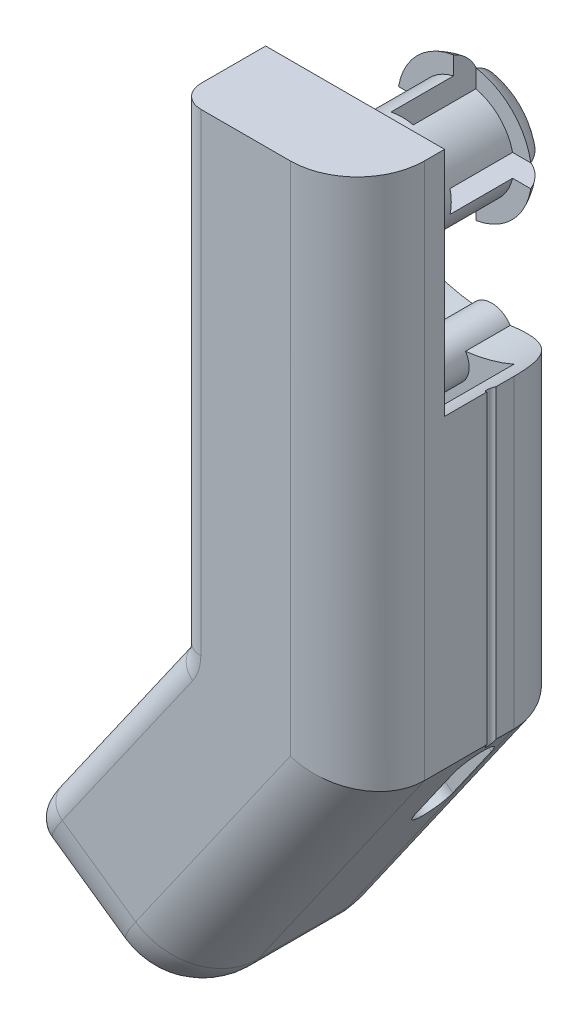
from build123d import *

# Parameters (mm, degrees)
BOSS_EXTRUDE1_DEPTH      = 5.715
BOSS_EXTRUDE1_DEPTH_BACK = 4.445
SKETCH2_R                = 2.7940000000000054
SKETCH3_W                = 1.269999999999993
SKETCH3_H                = 1.2700000000000102
CUT_EXTRUDE1_DEPTH       = 5.08
BOSS_EXTRUDE2_DEPTH      = 1.524
FILLET1_R                = 2.54
BOSS_EXTRUDE3_DEPTH      = 2.54
BOSS_EXTRUDE3_DEPTH_BACK = 2.413
SKETCH5_R                = 2.7940000000000054
BOSS_EXTRUDE4_DEPTH      = 7.747
CUT_EXTRUDE2_START       = -1.397
CUT_EXTRUDE2_DEPTH       = 5.207
CUT_EXTRUDE5_DEPTH       = 1.27
BOSS_EXTRUDE5_REACH      = 139.144
SKETCH11_R               = 1.2700000000000067
CUT_EXTRUDE6_DEPTH       = 37.8413328747807
CUT_EXTRUDE6_DEPTH_BACK  = 37.8413328747807
SKETCH12_R               = 0.25399999999999967
FILLET2_R                = 3.8099999999999996
FILLET3_R                = 3.8099999999999996
FILLET4_R                = 1.27


with BuildPart() as part:
    # Sketch2 → Boss-Extrude1 (new, two sides: drawn at the far end of the back side and taken through both)
    with BuildSketch(Plane.XY.offset(-BOSS_EXTRUDE1_DEPTH_BACK)):
        with Locations((-4.07886393202022, -93.55895801032833)):
            Circle(SKETCH2_R)
    extrude(amount=BOSS_EXTRUDE1_DEPTH + BOSS_EXTRUDE1_DEPTH_BACK)

    # Sketch3 → Cut-Extrude1 (cut)
    with BuildSketch(Plane(origin=(0, 0, -4.445), x_dir=(-1, 0, 0), z_dir=(0, 0, -1))):
        with BuildLine():
            Line((3.443863932020214, -94.1939580103283), (3.443863932020214, -92.9239580103283))
            Line((3.4438639320202142, -92.9239580103283), (1.357979700745413, -92.9239580103283))
            ThreePointArc((1.3579797007454042, -92.92395801032826), (1.3032030609678973, -93.23936024921431), (1.2848639320202149, -93.55895801032833))
            ThreePointArc((1.2848639320202149, -93.55895801032833), (1.3032030609678946, -93.87855577144232), (1.3579797007453935, -94.19395801032834))
            Line((1.357979700745402, -94.1939580103283), (3.4438639320202142, -94.1939580103283))
        make_face()
        with Locations((4.0788639320202105, -93.5589580103283)):
            Rectangle(SKETCH3_W, SKETCH3_H)
        with BuildLine():
            ThreePointArc((4.713863932020238, -90.8380737790535), (4.398461693134176, -90.783297139276), (4.078863932020155, -90.76495801032831))
            ThreePointArc((4.078863932020155, -90.76495801032831), (3.7592661709062294, -90.783297139276), (3.4438639320202613, -90.83807377905349))
            Line((3.4438639320202147, -90.83807377905347), (3.443863932020214, -92.9239580103283))
            Line((3.4438639320202142, -92.9239580103283), (4.713863932020207, -92.9239580103283))
            Line((4.713863932020207, -92.9239580103283), (4.713863932020208, -90.8380737790535))
        make_face()
        with BuildLine():
            Line((6.7997481632950585, -92.9239580103283), (4.713863932020207, -92.9239580103283))
            Line((4.713863932020207, -92.9239580103283), (4.713863932020207, -94.1939580103283))
            Line((4.713863932020207, -94.1939580103283), (6.7997481632950665, -94.1939580103283))
            ThreePointArc((6.79974816329506, -94.19395801032829), (6.854524803072549, -93.87855577144228), (6.872863932020225, -93.55895801032833))
            ThreePointArc((6.872863932020225, -93.55895801032833), (6.854524803072548, -93.23936024921436), (6.799748163295054, -92.92395801032833))
        make_face()
        with BuildLine():
            Line((4.713863932020207, -94.1939580103283), (3.4438639320202142, -94.1939580103283))
            Line((3.443863932020214, -94.1939580103283), (3.443863932020213, -96.27984224160318))
            ThreePointArc((3.4438639320202564, -96.27984224160316), (3.759266170906339, -96.33461888138066), (4.078863932020378, -96.35295801032834))
            ThreePointArc((4.078863932020378, -96.35295801032834), (4.398461693134285, -96.33461888138064), (4.713863932020234, -96.27984224160315))
            Line((4.713863932020206, -96.27984224160315), (4.713863932020207, -94.1939580103283))
        make_face()
    extrude(amount=-CUT_EXTRUDE1_DEPTH, mode=Mode.SUBTRACT)

    # Sketch4 → Boss-Extrude2 (add)
    with BuildSketch(Plane(origin=(0, 0, -4.445), x_dir=(-1, 0, 0), z_dir=(0, 0, -1))):
        with BuildLine():
            Line((0.3221532697519658, -92.9239580103283), (1.3579797007453935, -92.9239580103283))
            ThreePointArc((1.3579797007453953, -92.9239580103283), (2.103207585385001, -91.58330166369309), (3.4438639320202142, -90.83807377905349))
            Line((3.4438639320202116, -90.83807377905349), (3.443863932020211, -89.80224734806006))
            ThreePointArc((3.443863932020212, -89.80224734806006), (1.3847870956994783, -90.86488117400758), (0.32215326975196623, -92.9239580103283))
        make_face()
        with BuildLine():
            Line((3.4438639320202147, -97.31566867259657), (3.4438639320202142, -96.27984224160315))
            ThreePointArc((3.4438639320202133, -96.27984224160315), (2.1032075853849914, -95.53461435696353), (1.357979700745386, -94.1939580103283))
            Line((1.357979700745385, -94.1939580103283), (0.32215326975196246, -94.1939580103283))
            ThreePointArc((0.3221532697519591, -94.1939580103283), (1.384787095699461, -96.25303484664906), (3.443863932020211, -97.31566867259659))
        make_face()
        with BuildLine():
            Line((4.713863932020205, -96.27984224160316), (4.713863932020205, -97.31566867259659))
            ThreePointArc((4.713863932020205, -97.31566867259659), (6.772940768340969, -96.25303484664907), (7.835574594288481, -94.1939580103283))
            Line((7.835574594288476, -94.1939580103283), (6.799748163295053, -94.1939580103283))
            ThreePointArc((6.7997481632950505, -94.1939580103283), (6.054520278655442, -95.53461435696354), (4.713863932020206, -96.27984224160316))
        make_face()
        with BuildLine():
            Line((4.713863932020206, -89.80224734806005), (4.713863932020206, -90.83807377905347))
            ThreePointArc((4.713863932020207, -90.83807377905347), (6.054520278655426, -91.58330166369309), (6.799748163295044, -92.9239580103283))
            Line((6.799748163295046, -92.9239580103283), (7.835574594288472, -92.9239580103283))
            ThreePointArc((7.835574594288474, -92.9239580103283), (6.772940768340954, -90.86488117400756), (4.713863932020203, -89.80224734806006))
        make_face()
    extrude(amount=-BOSS_EXTRUDE2_DEPTH)

    # Fillet1
    # the kernel refuses this fillet: 2.54 mm, written as the material it takes off along each edge
    with BuildSketch(Plane(origin=(-4.0788639320202495, -93.55895801032834, -4.445), x_dir=(-0.9779601169479317, 0.2087917854207577, 0), z_dir=(-0.2087917854207577, -0.9779601169479317, 0))) as fillet1_piece_1:
        with BuildLine():
            CenterArc((1.4820515469624638, -2.54), FILLET1_R, 23.578178478201842, 66.42182152179817)
            Line((1.4820515469624638, 0), (1.4820515469624638, 0.05079999999999973))
            Line((1.4820515469624638, 0.05079999999999973), (3.8100000000000294, 0.05079999999999973))
            Line((3.8100000000000294, 0.05079999999999973), (3.8608000000000278, 0))
            ThreePointArc((3.8608000000000278, 0), (3.860800000000029, -0.762), (3.8565589690607793, -1.5036800000000001))
            Line((3.8565589690607793, -1.5036800000000001), (3.81000000000003, -1.524))
        make_face()
    revolve(axis=Axis((-4.0788639320202495, -93.55895801032834, -4.445), (0, 0, -1)), revolution_arc=245.89688563167445, mode=Mode.SUBTRACT)
    with BuildSketch(Plane(origin=(-4.078863932020237, -93.55895801032833, -4.445), x_dir=(0.20879178542072774, 0.9779601169479382, 0), z_dir=(-0.9779601169479382, 0.20879178542072774, 0))) as fillet1_piece_2:
        with BuildLine():
            CenterArc((1.4820515469624473, -2.54), FILLET1_R, 23.578178478201917, 66.42182152179808)
            Line((1.4820515469624473, 0), (1.4820515469624473, 0.05079999999999973))
            Line((1.4820515469624473, 0.05079999999999973), (3.8100000000000094, 0.05079999999999973))
            Line((3.8100000000000094, 0.05079999999999973), (3.8608000000000127, 0))
            ThreePointArc((3.8608000000000127, 0), (3.8608000000000127, -0.7619999999999991), (3.8565589690607562, -1.5036799999999984))
            Line((3.8565589690607562, -1.5036799999999984), (3.810000000000009, -1.5239999999999982))
        make_face()
    revolve(axis=Axis((-4.078863932020237, -93.55895801032833, -4.445), (0, 0, -1)), revolution_arc=245.89688563167698, mode=Mode.SUBTRACT)
    with BuildSketch(Plane(origin=(-4.078863932020216, -93.55895801032833, -4.445), x_dir=(0.9779601169479387, -0.2087917854207255, 0), z_dir=(0.2087917854207255, 0.9779601169479387, 0))) as fillet1_piece_3:
        with BuildLine():
            CenterArc((1.482051546962437, -2.5400000000000005), FILLET1_R, 23.578178478201817, 66.42182152179818)
            Line((1.482051546962437, 0), (1.482051546962437, 0.05079999999999975))
            Line((1.482051546962437, 0.05079999999999975), (3.8100000000000045, 0.05079999999999975))
            Line((3.8100000000000045, 0.05079999999999975), (3.860800000000004, 0))
            ThreePointArc((3.860800000000004, 0), (3.860800000000005, -0.7620000000000007), (3.856558969060754, -1.503680000000001))
            Line((3.856558969060754, -1.503680000000001), (3.810000000000004, -1.524000000000001))
        make_face()
    revolve(axis=Axis((-4.078863932020216, -93.55895801032833, -4.445), (0, 0, -1)), revolution_arc=245.89688563167826, mode=Mode.SUBTRACT)
    with BuildSketch(Plane(origin=(-4.078863932020221, -93.55895801032833, -4.445), x_dir=(-0.20879178542073795, -0.9779601169479358, 0), z_dir=(0.9779601169479358, -0.20879178542073795, 0))) as fillet1_piece_4:
        with BuildLine():
            CenterArc((1.482051546962436, -2.5399999999999996), FILLET1_R, 23.57817847820183, 66.42182152179817)
            Line((1.482051546962436, 0), (1.482051546962436, 0.05079999999999972))
            Line((1.482051546962436, 0.05079999999999972), (3.8100000000000027, 0.05079999999999972))
            Line((3.8100000000000027, 0.05079999999999972), (3.8608000000000064, 0))
            ThreePointArc((3.8608000000000064, 0), (3.8608000000000064, -0.7619999999999998), (3.85655896906075, -1.5036799999999997))
            Line((3.85655896906075, -1.5036799999999997), (3.8100000000000027, -1.5239999999999996))
        make_face()
    revolve(axis=Axis((-4.078863932020221, -93.55895801032833, -4.445), (0, 0, -1)), revolution_arc=245.8968856316771, mode=Mode.SUBTRACT)

    # Sketch5 → Boss-Extrude3 (add, two sides: drawn at the far end of the back side and taken through both)
    # profile 1 of 4: a face of its own
    with BuildSketch(Plane.XY.offset(5.714999999999999).offset(-BOSS_EXTRUDE3_DEPTH_BACK)):
        Polygon((-7.321448701996411, -113.13142141700175), (1.001136067979783, -118.95895801032833), (1.0011360679797812, -88.47895801032831), (-9.158863932020221, -88.47895801032831), (-9.158863932020218, -115.75552231531789), align=None)
        with Locations((-4.07886393202022, -93.55895801032833)):
            Circle(SKETCH5_R, mode=Mode.SUBTRACT)
    # profile 2 of 4: a face of its own
    with BuildSketch(Plane.XY.offset(5.714999999999999).offset(-BOSS_EXTRUDE3_DEPTH_BACK)):
        Polygon((-9.158863932020218, -118.95895801032833), (1.0011360679797825, -118.95895801032833), (-7.321448701996411, -113.13142141700175), (-9.15886393202022, -115.75552231531789), align=None)
    # profile 3 of 4: a face of its own
    with BuildSketch(Plane.XY.offset(5.714999999999999).offset(-BOSS_EXTRUDE3_DEPTH_BACK)):
        Polygon((-18.97652188864955, -129.77659095695412), (-10.653937118673376, -135.6041275502807), (1.0011360679797825, -118.95895801032833), (-9.158863932020218, -118.95895801032833), (-9.158863932020218, -115.75552231531789), align=None)
    # profile 4 of 4: a face of its own
    with BuildSketch(Plane.XY.offset(5.714999999999999).offset(-BOSS_EXTRUDE3_DEPTH_BACK)):
        with Locations((-4.07886393202022, -93.55895801032833)):
            Circle(SKETCH5_R)
    extrude(amount=BOSS_EXTRUDE3_DEPTH + BOSS_EXTRUDE3_DEPTH_BACK)

    # Sketch6 → Boss-Extrude4 (add)
    with BuildSketch(Plane(origin=(0, 0, 3.3019999999999996), x_dir=(-1, 0, 0), z_dir=(0, 0, -1))):
        with BuildLine():
            ThreePointArc((9.158863932020274, -101.61620474851374), (4.078863932020362, -103.08395801032833), (-1.0011360679795924, -101.6162047485139))
            Line((-1.0011360679797843, -101.61620474851397), (-1.0011360679797883, -118.95895801032833))
            Line((-1.0011360679797883, -118.95895801032833), (10.653937118673378, -135.60412755028074))
            Line((10.65393711867338, -135.60412755028074), (18.976521888649547, -129.77659095695415))
            Line((18.976521888649547, -129.77659095695415), (9.158863932020218, -115.75552231531788))
            Line((9.158863932020218, -115.75552231531788), (9.15886393202022, -101.61620474851372))
        make_face()
    extrude(amount=BOSS_EXTRUDE4_DEPTH)

    # Sketch9 → Cut-Extrude2 (cut)
    with BuildSketch(Plane(origin=(0, 0, 1.9049999999999978), x_dir=(-1, 0, 0), z_dir=(0, 0, -1)).offset(CUT_EXTRUDE2_START)):
        with BuildLine():
            ThreePointArc((7.8888639320202145, -102.2887647092192), (4.078863932020218, -103.08395801032832), (0.26886393202022063, -102.2887647092192))
            Line((0.2688639320202225, -102.2887647092192), (0.26886393202022446, -118.55852854845203))
            Line((0.2688639320202246, -118.55852854845203), (3.9794333963345054, -123.8577709327907))
            Line((3.9794333963345054, -123.8577709327907), (7.888863932020215, -115.47397009376135))
            Line((7.888863932020215, -115.47397009376135), (7.888863932020214, -102.2887647092192))
        make_face()
    extrude(amount=CUT_EXTRUDE2_DEPTH, mode=Mode.SUBTRACT)

    # Sketch10 → Cut-Extrude5 (cut)
    with BuildSketch(Plane(origin=(56.56419989406226, -39.606679158622775, 0), x_dir=(0, 0, -1), z_dir=(0.8191520442889951, -0.5735764363510415, 0))):
        with BuildLine():
            Line((0.45463666916395357, -98.77624558247483), (0.45463666916395473, -102.58624558247485))
            ThreePointArc((0.45463666916395473, -102.58624558247485), (-0.6349999999999958, -103.6758822516388), (-1.7246366691639448, -102.58624558247485))
            Line((-1.7246366691639448, -102.58624558247485), (-1.7246366691639459, -98.77624558247483))
            ThreePointArc((-1.7246366691639459, -98.77624558247483), (-0.6349999999999967, -97.68660891331088), (0.45463666916395357, -98.77624558247483))
        make_face()
    extrude(amount=-CUT_EXTRUDE5_DEPTH, mode=Mode.SUBTRACT)

    # Boss-Extrude5: up to this face of the body (flat: up to its plane)
    boss_extrude5_end = Plane(part.part.faces().sort_by_distance((-6.926760918, -118.442460809, -4.445))[0])
    # Sketch11 → Boss-Extrude5 (add, up to the picked face)
    with BuildSketch(Plane(origin=(0, 0, 3.3019999999999996), x_dir=(-1, 0, 0), z_dir=(0, 0, -1)), mode=Mode.PRIVATE) as boss_extrude5_sk1:
        with Locations(Location((4.07886393202022, -103.71895801032832, 0), (0, 0, 180))):
            Circle(SKETCH11_R)
    boss_extrude5_tool1 = split(extrude(boss_extrude5_sk1.sketch, amount=BOSS_EXTRUDE5_REACH, mode=Mode.PRIVATE), bisect_by=boss_extrude5_end, keep=Keep.BOTH, mode=Mode.PRIVATE)
    add(boss_extrude5_tool1.solids().sort_by(Axis((-4.078864, -103.718958, 3.302), (0, 0, -1)))[0])

    # Sketch12 → Cut-Extrude6 (cut, two sides: drawn at the far end of the back side and taken through both)
    with BuildSketch(Plane(origin=(6.77e-15, -118.95895801032833, 0), x_dir=(1.64e-15, 0, -1), z_dir=(6e-17, -1, 0)).offset(-CUT_EXTRUDE6_DEPTH_BACK)):
        with Locations((-0.6349999999999941, 1.0011360679797785)):
            Circle(SKETCH12_R)
    extrude(amount=CUT_EXTRUDE6_DEPTH + CUT_EXTRUDE6_DEPTH_BACK, mode=Mode.SUBTRACT)

    # Fillet2
    fillet2_edges = [part.edges().sort_by_distance(p)[0] for p in [
        (1.001136067979782, -103.71895801032832, 8.254999999999999),
        (-4.826400525346797, -127.28154278030452, 8.254999999999999),
        (-4.826400525346795, -127.28154278030453, -4.445),
        (1.0011360679797863, -110.28758137942114, -4.445),
    ]]
    fillet(fillet2_edges, radius=FILLET2_R)

    # Fillet3
    fillet3_edges = [part.edges().sort_by_distance(p)[0] for p in [
        (-16.375714148031996, -131.5976961423687, -4.445),
        (-10.653937118673378, -135.60412755028074, 1.9049999999999985),
        (-16.375714148032003, -131.59769614236868, 8.254999999999999),
        (-11.568047859470695, -134.964060318816, 7.139076836320746),
        (-11.568047859470676, -134.964060318816, -3.3290768363207524),
    ]]
    fillet(fillet3_edges, radius=FILLET3_R)

    # Fillet4
    fillet4_edges = [part.edges().sort_by_distance(p)[0] for p in [
        (-9.158863932020218, -115.75552231531788, 1.9049999999999994),
        (-9.15886393202022, -102.1172401628231, 8.254999999999999),
        (-9.158863932020218, -108.6858635319158, -4.445),
        (-12.975029799086151, -121.20557199176548, -4.445),
        (-12.975029799086162, -121.20557199176548, 8.254999999999999),
        (-18.976521888649547, -129.77659095695415, 1.9049999999999994),
        (-18.336454657184845, -128.86248021615683, -3.329076836320745),
        (-18.33645465718485, -128.86248021615685, 7.139076836320745),
    ]]
    fillet(fillet4_edges, radius=FILLET4_R)


solid = part.part
